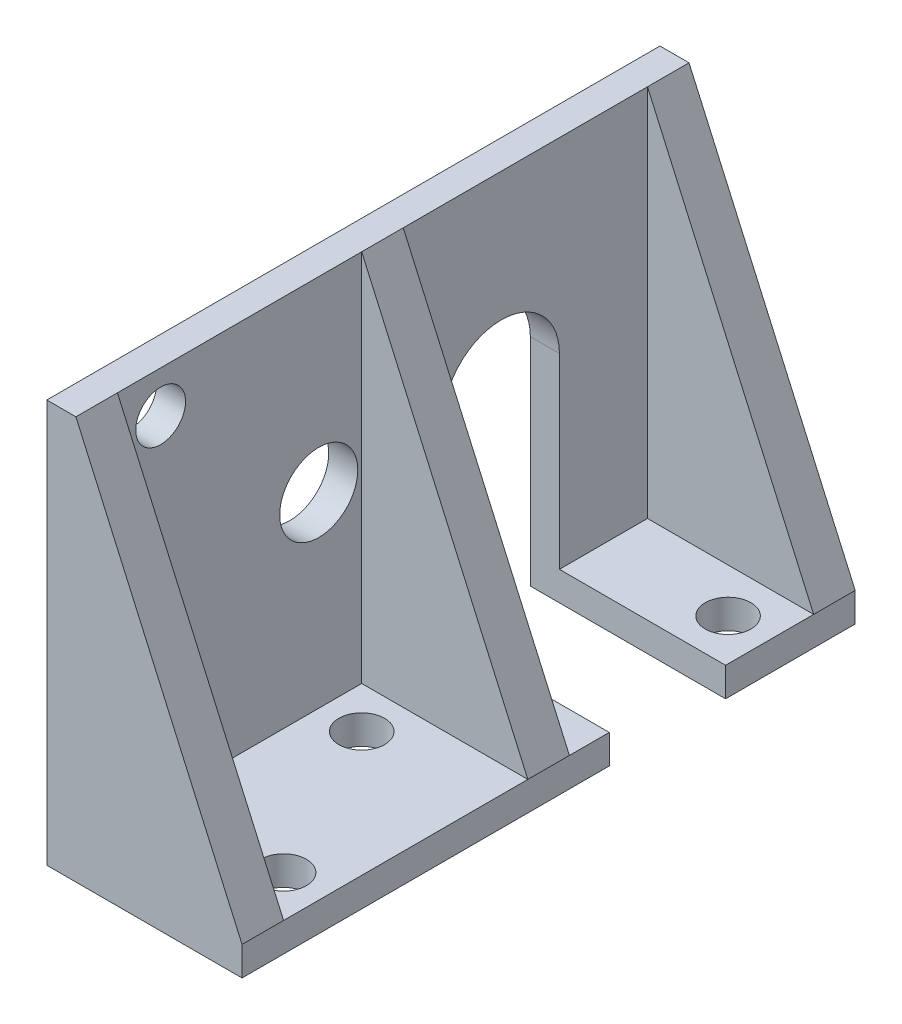
from build123d import *

# Parameters (mm, degrees)
SKETCH1_W                   = 36.9
SKETCH1_H                   = 22.5
BASEPLATE_DEPTH             = 1.75
SKETCH2_W                   = 11.75
SKETCH2_H                   = 36.9
BOSS_EXTRUDE2_DEPTH         = 1.75
SUPPORT1_REACH              = 46.788
SKETCH3_WALL_W              = 116.197196834
SKETCH3_WALL_H              = 2.5
SUPPORT3_REACH              = 33.38
SKETCH4_WALL_W              = 89.382482298
SKETCH4_WALL_H              = 2.5
SKETCH5_R                   = 1.5
MOTOR_MOUNTINGHOLES_DEPTH   = 45.360568076
SHAFTSLOT_DEPTH             = 45.787526165
SKETCH8_R                   = 1.375
CHASSIS_MOUNTINGHOLES_DEPTH = 45.787526165
SKETCH9_R                   = 2.35
INDENTHOLE_DEPTH            = 10


with BuildPart() as part:
    # Sketch1 → basePlate (new body)
    with BuildSketch(Plane(origin=(0, 0, 0), x_dir=(0, 0, -1), z_dir=(1, 0, 0))):
        with Locations((18.45, 11.25)):
            Rectangle(SKETCH1_W, SKETCH1_H)
    extrude(amount=BASEPLATE_DEPTH)

    # Sketch2 → Boss-Extrude2 (add)
    with BuildSketch(Plane.XZ):
        with Locations((5.875, -18.45)):
            Rectangle(SKETCH2_W, SKETCH2_H)
    extrude(amount=BOSS_EXTRUDE2_DEPTH)

    # Sketch3 wall → support1 (add, up to next)
    with BuildSketch(Plane(origin=(6.75, 11.25, 0), x_dir=(0.406138466053, -0.91381154862, 0), z_dir=(0.91381154862, 0.406138466053, 0)), mode=Mode.PRIVATE) as support1_sk1:
        with Locations((0, 1.25)):
            Rectangle(SKETCH3_WALL_W, SKETCH3_WALL_H)
    support1_tool1 = extrude(support1_sk1.sketch, amount=-SUPPORT1_REACH, mode=Mode.PRIVATE) - part.part
    support1 = support1_tool1.solids().sort_by_distance((6.75, 11.25, 0))[0]
    add(support1)

    # support2: support1 across plane
    add(support1.mirror(Plane.XY.offset(-18.45)))

    # Sketch4 wall → support3 (add, up to next)
    with BuildSketch(Plane(origin=(6.75, 11.25, -18.45), x_dir=(0.406138466053, -0.91381154862, 0), z_dir=(0.91381154862, 0.406138466053, 0)), mode=Mode.PRIVATE) as support3_sk1:
        Rectangle(SKETCH4_WALL_W, SKETCH4_WALL_H)
    support3_tool1 = extrude(support3_sk1.sketch, amount=-SUPPORT3_REACH, mode=Mode.PRIVATE) - part.part
    add(support3_tool1.solids().sort_by_distance((6.75, 11.25, -18.45))[0])

    # Sketch5 → motor_mountingHoles (cut, through all)
    with BuildSketch(Plane(origin=(1.75, 0, 0), x_dir=(0, 0, -1), z_dir=(1, 0, 0))):
        with Locations((5.1, 2.5)):
            Circle(SKETCH5_R)
        with Locations((5.1, 20)):
            Circle(SKETCH5_R)
    extrude(amount=-MOTOR_MOUNTINGHOLES_DEPTH, mode=Mode.SUBTRACT)

    # Sketch7 → shaftSlot (cut, through all)
    with BuildSketch(Plane(origin=(11.75, 0, 0), x_dir=(0, 0, -1), z_dir=(1, 0, 0))):
        with BuildLine():
            Line((22.1, -1.75), (22.1, 11.25))
            ThreePointArc((22.1, 11.25), (25.6, 14.75), (29.1, 11.25))
            Line((29.1, 11.25), (29.1, -1.75))
            Line((29.1, -1.75), (22.1, -1.75))
        make_face()
    extrude(amount=-SHAFTSLOT_DEPTH, mode=Mode.SUBTRACT)

    # Sketch8 → chassis_mountingHoles (cut, through all)
    with BuildSketch(Plane(origin=(0, 0, 0), x_dir=(1, 0, 0), z_dir=(0, 1, 0))):
        with Locations((9.25, 5)):
            Circle(SKETCH8_R)
        with Locations((4.25, 14.7)):
            Circle(SKETCH8_R)
        with Locations((9.25, 31.75)):
            Circle(SKETCH8_R)
    extrude(amount=-CHASSIS_MOUNTINGHOLES_DEPTH, mode=Mode.SUBTRACT)

    # Sketch9 → indentHole (cut)
    with BuildSketch(Plane(origin=(1.75, 0, 0), x_dir=(0, 0, -1), z_dir=(1, 0, 0))):
        with Locations((14.615, 11.25)):
            Circle(SKETCH9_R)
    extrude(amount=-INDENTHOLE_DEPTH, mode=Mode.SUBTRACT)


solid = part.part
